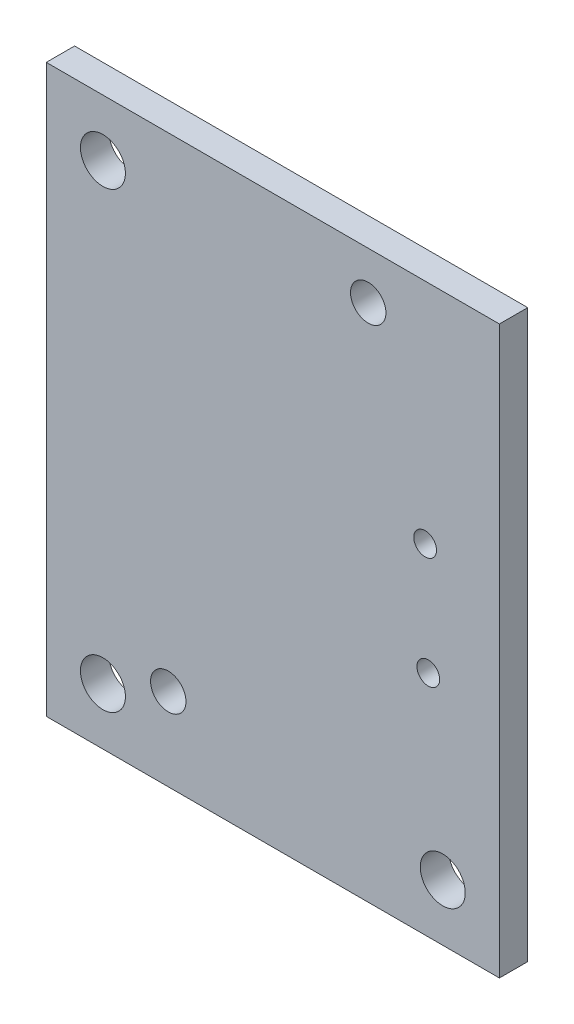
from build123d import *

# Parameters (mm, degrees)
SKETCH2_W                       = 127
SKETCH2_H                       = 101.6
BOSS_EXTRUDE1_DEPTH             = 6.35
F_3_8_CLEARANCE_HOLE1_D         = 10.0838
TAP_DRILL_FOR_1_4_20_TAP1_D     = 5.1054
TAP_DRILL_FOR_3_8_16_TAP2_D     = 7.9375
TAP_DRILL_FOR_3_8_16_TAP2_DEPTH = 12.7
TAP_DRILL_FOR_3_8_16_TAP2_TIP   = 2.384665582


with BuildPart() as part:
    # Sketch2 → Boss-Extrude1 (new body)
    with BuildSketch(Plane(origin=(0, 0, 0), x_dir=(0, 1, 0), z_dir=(0, 0, 1))):
        with Locations((63.5, 50.8)):
            Rectangle(SKETCH2_W, SKETCH2_H)
    extrude(amount=BOSS_EXTRUDE1_DEPTH)

    # 3/8 Clearance Hole1 (through all)
    with Locations(Plane.XY.offset(6.35)):
        with Locations((-12.7, 12.7), (-88.9, 12.7), (-88.9, 114.3)):
            Hole(F_3_8_CLEARANCE_HOLE1_D / 2)

    # Tap Drill for 1/4-20 Tap1 (through all)
    with Locations(Plane.XY.offset(6.35)):
        with Locations((-15.944676921, 51.261023869), (-16.6512181, 75.991192202)):
            Hole(TAP_DRILL_FOR_1_4_20_TAP1_D / 2)

    # Tap Drill for 3/8-16 Tap2
    with Locations(Plane.XY.offset(6.35)):
        with Locations((-74.250326818, 18.519375606), (-29.415205463, 116.419512271)):
            Hole(TAP_DRILL_FOR_3_8_16_TAP2_D / 2, depth=TAP_DRILL_FOR_3_8_16_TAP2_DEPTH)
            with Locations((0, 0, -(TAP_DRILL_FOR_3_8_16_TAP2_DEPTH + TAP_DRILL_FOR_3_8_16_TAP2_TIP / 2))):  # 118° drill point
                Cone(0, TAP_DRILL_FOR_3_8_16_TAP2_D / 2, TAP_DRILL_FOR_3_8_16_TAP2_TIP, mode=Mode.SUBTRACT)


solid = part.part
